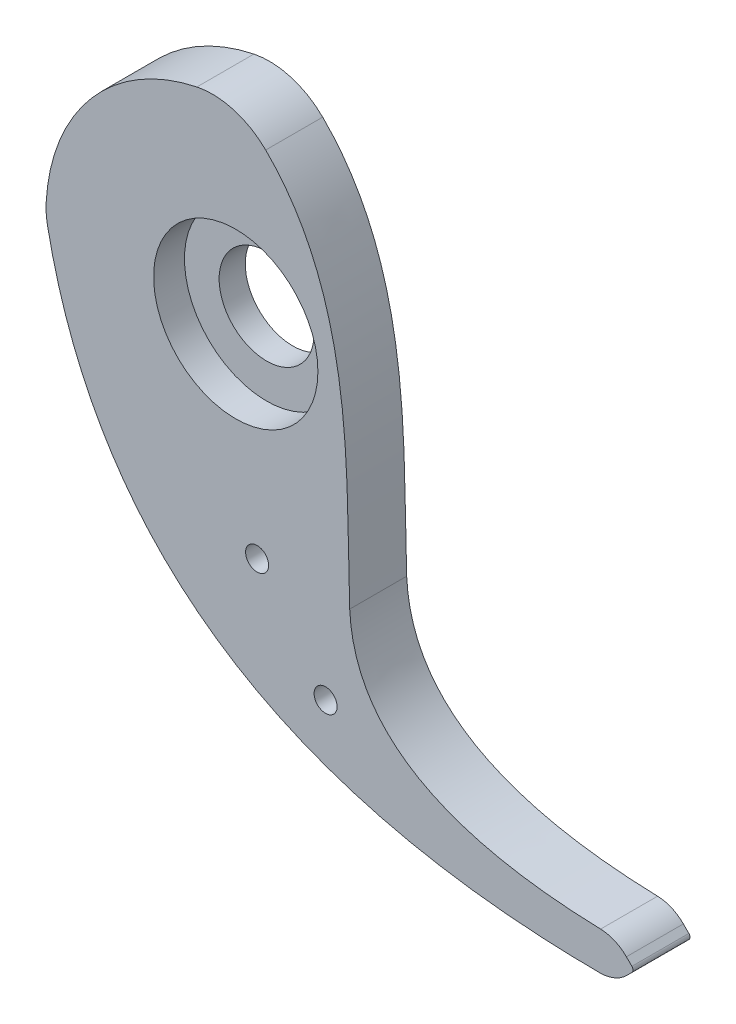
from build123d import *

# Parameters (mm, degrees)
CROQUIS1_R              = 10
SALIENTE_EXTRUIR1_DEPTH = 100
CORTAR_EXTRUIR4_DEPTH   = 15
CROQUIS3_W              = 244.799963401
CROQUIS3_H              = 159.784694376
CORTAR_EXTRUIR5_DEPTH   = 35
CROQUIS4_W              = 177.681228393
CROQUIS4_H              = 202.290816813
CORTAR_EXTRUIR6_DEPTH   = 50
CAVIDAD1_START          = 90.384084462
CAVIDAD1_OUTLINE_R      = 5.05
CAVIDAD1_DEPTH          = 9.615915538
CAVIDAD1_START_2        = 85
CAVIDAD1_2_OUTLINE_R    = 3.03
CAVIDAD1_2_DEPTH        = 5.384084462
CROQUIS5_R              = 21
CORTAR_EXTRUIR7_DEPTH   = 8
CROQUIS6_R              = 12.5
CORTAR_EXTRUIR8_DEPTH   = 8
SALIENTE_EXTRUIR2_START = 8
CROQUIS7_R              = 21
CROQUIS7_R_2            = 12.5
SALIENTE_EXTRUIR2_DEPTH = 8
CROQUIS8_R              = 21
CORTAR_EXTRUIR9_DEPTH   = 8
CAVIDAD2_START          = 85
CAVIDAD2_OUTLINE_R      = 21.63
CAVIDAD2_DEPTH          = 8.12


# Read off the part's stored shape, not the designer's step: Cavidad1, Cavidad2
with BuildPart() as part:
    # Croquis1 → Saliente-Extruir1 (new body)
    with BuildSketch(Plane.XY):
        with BuildLine():
            Line((102.84709295, -92.84709295), (104.292893219, -94.292893219))
            ThreePointArc((104.292893219, -94.292893219), (104.585786438, -95), (104.292893219, -95.707106781))
            Line((104.292893219, -95.707106781), (102.924090823, -97.075909177))
            ThreePointArc((102.924090823, -97.075909177), (99.655924863, -99.253513567), (95.801242309, -100.004707302))
            add(Edge.make_bspline(
                [(-49.58600728, -2.205776949), (-47.044709507, -15.23286343), (-27.045253615, -73.563310407), (28.636670051, -99.656919769), (95.801242309, -100.004707302)],
                knots=[0.011039812, 0.011039812, 0.011039812, 0.011039812, 0.207725041, 0.983937689, 0.983937689, 0.983937689, 0.983937689], degree=3))
            ThreePointArc((-49.58600728, -2.205776949), (-49.90808847, 0.239585929), (-49.92672205, 2.705998037))
            ThreePointArc((-49.92672205, 2.705998037), (-37.935964584, 32.570885635), (-10.229250857, 48.942439936))
            ThreePointArc((-10.229250857, 48.942439936), (-0.503550938, 48.555514737), (7.88775097, 43.623476385))
            add(Edge.make_bspline(
                [(30, -50), (29.065577858, -23.91659264), (31.451883129, 15.353668912), (10.5535399, 41.001196903), (7.88775097, 43.623476385)],
                knots=[0, 0, 0, 0, 0.805376889, 0.908560603, 0.908560603, 0.908560603, 0.908560603], degree=3))
            add(Edge.make_bspline(
                [(96.061432126, -89.922234449), (74.639632489, -89.310592156), (42.207594165, -82.045244121), (30.598677739, -62.69576919), (30, -50)],
                knots=[0.027764728, 0.027764728, 0.027764728, 0.027764728, 0.487449894, 0.947135059, 0.947135059, 0.947135059, 0.947135059], degree=3))
            ThreePointArc((96.061432126, -89.922234449), (99.734323975, -90.734922209), (102.84709295, -92.84709295))
        make_face()
        Circle(CROQUIS1_R, mode=Mode.SUBTRACT)
    extrude(amount=SALIENTE_EXTRUIR1_DEPTH)

    # Croquis2 → Cortar-Extruir4 (cut)
    with BuildSketch(Plane(origin=(0, 0, 0), x_dir=(-1, 0, 0), z_dir=(0, 0, -1))):
        with BuildLine():
            ThreePointArc((1.102623365, 39.984799883), (1.653330869, 39.965816607), (2.203724614, 39.939248839))
            ThreePointArc((2.203724614, 39.939248839), (3.208029629, 37.678468026), (3.853201686, 35.290265468))
            ThreePointArc((3.853201686, 35.290265468), (4.391380959, 35.227344113), (4.928537187, 35.156215968))
            ThreePointArc((4.928537187, 35.156215968), (6.140272041, 37.312939662), (7.668866774, 39.257973488))
            ThreePointArc((7.668866774, 39.257973488), (8.208938801, 39.148605643), (8.747452981, 39.031808392))
            ThreePointArc((8.747452981, 39.031808392), (9.365948293, 36.63655851), (9.609235823, 34.174736091))
            ThreePointArc((9.609235823, 34.174736091), (10.129718517, 34.024091505), (10.647841327, 33.865520446))
            ThreePointArc((10.647841327, 33.865520446), (12.198034749, 35.793384238), (14.025923488, 37.460291914))
            ThreePointArc((14.025923488, 37.460291914), (14.540628281, 37.263522769), (15.052573634, 37.05968196))
            ThreePointArc((15.052573634, 37.05968196), (15.268388303, 34.595299183), (15.103155055, 32.127009001))
            ThreePointArc((15.103155055, 32.127009001), (15.591743761, 31.892750375), (16.076700112, 31.651061807))
            ThreePointArc((16.076700112, 31.651061807), (17.923066867, 33.297478598), (20.000389573, 34.640791229))
            ThreePointArc((20.000389573, 34.640791229), (20.475687326, 34.361988134), (20.947099317, 34.076664012))
            ThreePointArc((20.947099317, 34.076664012), (20.754346482, 31.610370276), (20.18509959, 29.202940855))
            ThreePointArc((20.18509959, 29.202940855), (20.628466879, 28.891458153), (21.067028427, 28.57324471))
            ThreePointArc((21.067028427, 28.57324471), (23.159204443, 29.893304542), (25.429297167, 30.87638006))
            ThreePointArc((25.429297167, 30.87638006), (25.852222997, 30.523148037), (26.270242736, 30.164123501))
            ThreePointArc((26.270242736, 30.164123501), (25.674180192, 27.763192871), (24.716447225, 25.482292608))
            ThreePointArc((24.716447225, 25.482292608), (25.102499195, 25.102082267), (25.482703124, 24.716023982))
            ThreePointArc((25.482703124, 24.716023982), (27.763619294, 25.673719065), (30.164559823, 26.269741732))
            ThreePointArc((30.164559823, 26.269741732), (30.523577417, 25.85171603), (30.876802415, 25.428784332))
            ThreePointArc((30.876802415, 25.428784332), (29.893689193, 23.158707937), (28.573594612, 21.066553846))
            ThreePointArc((28.573594612, 21.066553846), (28.891800771, 20.627987013), (29.203276108, 20.18461455))
            ThreePointArc((29.203276108, 20.18461455), (31.610714984, 20.753821458), (34.077011921, 20.94653333))
            ThreePointArc((34.077011921, 20.94653333), (34.362328213, 20.4751166), (34.641123413, 19.999814215))
            ThreePointArc((34.641123413, 19.999814215), (33.297776281, 17.922513822), (31.651328823, 16.076174412))
            ThreePointArc((31.651328823, 16.076174412), (31.893009337, 15.591214047), (32.127259848, 15.102621451))
            ThreePointArc((32.127259848, 15.102621451), (34.595552773, 15.267813702), (37.059931966, 15.051958102))
            ThreePointArc((37.059931966, 15.051958102), (37.263764272, 14.540009363), (37.460524868, 14.025301302))
            ThreePointArc((37.460524868, 14.025301302), (35.793586832, 12.197440249), (33.865697293, 10.647278847))
            ThreePointArc((33.865697293, 10.647278847), (34.024259747, 10.129153404), (34.174895688, 9.608668207))
            ThreePointArc((34.174895688, 9.608668207), (36.636714066, 9.365339789), (39.031953674, 8.746804694))
            ThreePointArc((39.031953674, 8.746804694), (39.148741981, 8.208288574), (39.258100856, 7.668214731))
            ThreePointArc((39.258100856, 7.668214731), (37.313041641, 6.139652303), (35.156297822, 4.927953271))
            ThreePointArc((35.156297822, 4.927953271), (35.227417046, 4.390795861), (35.290329461, 3.852615543))
            ThreePointArc((35.290329461, 3.852615543), (37.678521304, 3.20740382), (39.939285436, 2.203061256))
            ThreePointArc((39.939285436, 2.203061256), (39.965844062, 1.65266707), (39.984818192, 1.101959251))
            ThreePointArc((39.984818192, 1.101959251), (37.814693942, -0.085609353), (35.487926192, -0.925794025))
            ThreePointArc((35.487926192, -0.925794025), (35.469662238, -1.467331147), (35.443135042, -2.00852643))
            ThreePointArc((35.443135042, -2.00852643), (37.692556701, -3.038021764), (39.757177604, -4.400775951))
            ThreePointArc((39.757177604, -4.400775951), (39.692782099, -4.948034883), (39.620853919, -5.494354805))
            ThreePointArc((39.620853919, -5.494354805), (37.284859968, -6.308535809), (34.851536446, -6.754288072))
            ThreePointArc((34.851536446, -6.754288072), (34.744387508, -7.285433186), (34.629144292, -7.814881038))
            ThreePointArc((34.629144292, -7.814881038), (36.678437409, -9.200578033), (38.490597607, -10.884571461))
            ThreePointArc((38.490597607, -10.884571461), (38.337004513, -11.413767343), (38.176136036, -11.940797184))
            ThreePointArc((38.176136036, -11.940797184), (35.737992209, -12.359381853), (33.264487636, -12.398542748))
            ThreePointArc((33.264487636, -12.398542748), (33.071376458, -12.904807599), (32.870560757, -13.408066063))
            ThreePointArc((32.870560757, -13.408066063), (34.663825958, -15.112166519), (36.174094444, -17.071464236))
            ThreePointArc((36.174094444, -17.071464236), (35.935493381, -17.568161984), (35.690072679, -18.061525743))
            ThreePointArc((35.690072679, -18.061525743), (33.216285184, -18.073096179), (30.770070318, -17.704597499))
            ThreePointArc((30.770070318, -17.704597499), (30.496264469, -18.172172502), (30.215354012, -18.635513998))
            ThreePointArc((30.215354012, -18.635513998), (31.703675696, -20.611534496), (32.870856284, -22.792691969))
            ThreePointArc((32.870856284, -22.792691969), (32.553755666, -23.243342962), (32.230477177, -23.689582963))
            ThreePointArc((32.230477177, -23.689582963), (29.788524487, -23.293823554), (27.436325694, -22.527716982))
            ThreePointArc((27.436325694, -22.527716982), (27.089293883, -22.94384791), (26.735951175, -23.35463369))
            ThreePointArc((26.735951175, -23.35463369), (27.878731807, -25.548673542), (28.670986852, -27.89219448))
            ThreePointArc((28.670986852, -27.89219448), (28.284036357, -28.284506136), (27.891718275, -28.671450114))
            ThreePointArc((27.891718275, -28.671450114), (25.548210496, -27.879156145), (23.354189625, -26.736339072))
            ThreePointArc((23.354189625, -26.736339072), (22.943397976, -27.089674957), (22.527261285, -27.436699856))
            ThreePointArc((22.527261285, -27.436699856), (23.293328789, -29.788911374), (23.689047639, -32.230870636))
            ThreePointArc((23.689047639, -32.230870636), (23.242802268, -32.554141714), (22.792146008, -32.871234847))
            ThreePointArc((22.792146008, -32.871234847), (20.611007921, -31.704018032), (18.635012143, -30.215663528))
            ThreePointArc((18.635012143, -30.215663528), (18.171665982, -30.496566289), (17.704086432, -30.770364373))
            ThreePointArc((17.704086432, -30.770364373), (18.072544482, -33.216585358), (18.060932958, -35.690372661))
            ThreePointArc((18.060932958, -35.690372661), (17.567565123, -35.935785168), (17.070863412, -36.174377982))
            ThreePointArc((17.070863412, -36.174377982), (15.111590779, -34.664076954), (13.407520108, -32.870783449))
            ThreePointArc((13.407520108, -32.870783449), (12.90425831, -33.071590791), (12.397990251, -33.264693561))
            ThreePointArc((12.397990251, -33.264693561), (12.358788274, -35.738197483), (11.940163108, -38.176334357))
            ThreePointArc((11.940163108, -38.176334357), (11.413130596, -38.337194081), (10.883932163, -38.490778385))
            ThreePointArc((10.883932163, -38.490778385), (9.199968834, -36.678590218), (7.814305875, -34.629274085))
            ThreePointArc((7.814305875, -34.629274085), (7.28485611, -34.744508508), (6.753709216, -34.851648624))
            ThreePointArc((6.753709216, -34.851648624), (6.307916538, -37.284964743), (5.493696735, -39.62094517))
            ThreePointArc((5.493696735, -39.62094517), (4.947375618, -39.692864277), (4.400115616, -39.757250692))
            ThreePointArc((4.400115616, -39.757250692), (3.037395721, -37.692607155), (2.007937749, -35.443168397))
            ThreePointArc((2.007937749, -35.443168397), (1.466742025, -35.469686605), (0.9252046, -35.487941564))
            ThreePointArc((0.9252046, -35.487941564), (0.084981283, -37.814695359), (-1.102623365, -39.984799883))
            ThreePointArc((-1.102623365, -39.984799883), (-1.653330869, -39.965816607), (-2.203724614, -39.939248839))
            ThreePointArc((-2.203724614, -39.939248839), (-3.208029629, -37.678468026), (-3.853201686, -35.290265468))
            ThreePointArc((-3.853201686, -35.290265468), (-4.391380959, -35.227344113), (-4.928537187, -35.156215968))
            ThreePointArc((-4.928537187, -35.156215968), (-6.140272041, -37.312939662), (-7.668866774, -39.257973488))
            ThreePointArc((-7.668866774, -39.257973488), (-8.208938801, -39.148605643), (-8.747452981, -39.031808392))
            ThreePointArc((-8.747452981, -39.031808392), (-9.365948293, -36.63655851), (-9.609235823, -34.174736091))
            ThreePointArc((-9.609235823, -34.174736091), (-10.129718517, -34.024091505), (-10.647841327, -33.865520446))
            ThreePointArc((-10.647841327, -33.865520446), (-12.198034749, -35.793384238), (-14.025923488, -37.460291914))
            ThreePointArc((-14.025923488, -37.460291914), (-14.540628281, -37.263522769), (-15.052573634, -37.05968196))
            ThreePointArc((-15.052573634, -37.05968196), (-15.268388303, -34.595299183), (-15.103155055, -32.127009001))
            ThreePointArc((-15.103155055, -32.127009001), (-15.591743761, -31.892750375), (-16.076700112, -31.651061807))
            ThreePointArc((-16.076700112, -31.651061807), (-17.923066867, -33.297478598), (-20.000389573, -34.640791229))
            ThreePointArc((-20.000389573, -34.640791229), (-20.475687326, -34.361988134), (-20.947099317, -34.076664012))
            ThreePointArc((-20.947099317, -34.076664012), (-20.754346482, -31.610370276), (-20.18509959, -29.202940855))
            ThreePointArc((-20.18509959, -29.202940855), (-20.628466879, -28.891458153), (-21.067028427, -28.57324471))
            ThreePointArc((-21.067028427, -28.57324471), (-23.159204443, -29.893304542), (-25.429297167, -30.87638006))
            ThreePointArc((-25.429297167, -30.87638006), (-25.852222997, -30.523148037), (-26.270242736, -30.164123501))
            ThreePointArc((-26.270242736, -30.164123501), (-25.674180192, -27.763192871), (-24.716447225, -25.482292608))
            ThreePointArc((-24.716447225, -25.482292608), (-25.102499195, -25.102082267), (-25.482703124, -24.716023982))
            ThreePointArc((-25.482703124, -24.716023982), (-27.421409872, -25.555856409), (-29.453588357, -26.133916065))
            add(Edge.make_bspline(
                [(-30, -50), (-29.734872846, -42.599255467), (-29.715262914, -34.495945215), (-29.453588357, -26.133916065)],
                knots=[0, 0, 0, 0, 0.228512653, 0.228512653, 0.228512653, 0.228512653], degree=3))
            add(Edge.make_bspline(
                [(-96.061432126, -89.922234449), (-74.639632489, -89.310592156), (-42.207594165, -82.045244121), (-30.598677739, -62.69576919), (-30, -50)],
                knots=[0.027764728, 0.027764728, 0.027764728, 0.027764728, 0.487449894, 0.947135059, 0.947135059, 0.947135059, 0.947135059], degree=3))
            ThreePointArc((-96.061432126, -89.922234449), (-99.734323975, -90.734922209), (-102.84709295, -92.84709295))
            Line((-102.84709295, -92.84709295), (-104.292893219, -94.292893219))
            ThreePointArc((-104.292893219, -94.292893219), (-104.585786438, -95), (-104.292893219, -95.707106781))
            Line((-104.292893219, -95.707106781), (-102.924090823, -97.075909177))
            ThreePointArc((-102.924090823, -97.075909177), (-99.655924863, -99.253513567), (-95.801242309, -100.004707302))
            add(Edge.make_bspline(
                [(49.58600728, -2.205776949), (47.044709507, -15.23286343), (27.045253615, -73.563310407), (-28.636670051, -99.656919769), (-95.801242309, -100.004707302)],
                knots=[0.011039812, 0.011039812, 0.011039812, 0.011039812, 0.207725041, 0.983937689, 0.983937689, 0.983937689, 0.983937689], degree=3))
            ThreePointArc((49.58600728, -2.205776949), (49.90808847, 0.239585929), (49.92672205, 2.705998037))
            ThreePointArc((49.92672205, 2.705998037), (37.935964584, 32.570885635), (10.229250857, 48.942439936))
            ThreePointArc((10.229250857, 48.942439936), (0.503550938, 48.555514737), (-7.88775097, 43.623476385))
            add(Edge.make_bspline(
                [(-15.182020199, 34.727214957), (-15.121605489, 34.818294405), (-12.99668952, 38.002837294), (-10.5535399, 41.001196903), (-7.88775097, 43.623476385)],
                knots=[0.802344073, 0.802344073, 0.802344073, 0.802344073, 0.805376889, 0.908560603, 0.908560603, 0.908560603, 0.908560603], degree=3))
            ThreePointArc((-15.182020199, 34.727214957), (-14.257602386, 33.834526615), (-13.407520108, 32.870783449))
            ThreePointArc((-13.407520108, 32.870783449), (-12.90425831, 33.071590791), (-12.397990251, 33.264693561))
            ThreePointArc((-12.397990251, 33.264693561), (-12.358788274, 35.738197483), (-11.940163108, 38.176334357))
            ThreePointArc((-11.940163108, 38.176334357), (-11.413130596, 38.337194081), (-10.883932163, 38.490778385))
            ThreePointArc((-10.883932163, 38.490778385), (-9.199968834, 36.678590218), (-7.814305875, 34.629274085))
            ThreePointArc((-7.814305875, 34.629274085), (-7.28485611, 34.744508508), (-6.753709216, 34.851648624))
            ThreePointArc((-6.753709216, 34.851648624), (-6.307916538, 37.284964743), (-5.493696735, 39.62094517))
            ThreePointArc((-5.493696735, 39.62094517), (-4.947375618, 39.692864277), (-4.400115616, 39.757250692))
            ThreePointArc((-4.400115616, 39.757250692), (-3.037395721, 37.692607155), (-2.007937749, 35.443168397))
            ThreePointArc((-2.007937749, 35.443168397), (-1.466742025, 35.469686605), (-0.9252046, 35.487941564))
            ThreePointArc((-0.9252046, 35.487941564), (-0.084981283, 37.814695359), (1.102623365, 39.984799883))
        make_face()
    extrude(amount=-CORTAR_EXTRUIR4_DEPTH, mode=Mode.SUBTRACT)

    # Croquis3 → Cortar-Extruir5 (cut)
    with BuildSketch(Plane(origin=(0, 0, 0), x_dir=(-1, 0, 0), z_dir=(0, 0, -1))):
        with Locations((-26.261343778, -29.231181028)):
            Rectangle(CROQUIS3_W, CROQUIS3_H)
    extrude(amount=-CORTAR_EXTRUIR5_DEPTH, mode=Mode.SUBTRACT)

    # Croquis4 → Cortar-Extruir6 (cut)
    with BuildSketch(Plane(origin=(0, 0, 35), x_dir=(-1, 0, 0), z_dir=(0, 0, -1))):
        with Locations((-31.414152083, -26.798932517)):
            Rectangle(CROQUIS4_W, CROQUIS4_H)
    extrude(amount=-CORTAR_EXTRUIR6_DEPTH, mode=Mode.SUBTRACT)

    # Cavidad1 outline → Cavidad1 (cut)
    with BuildSketch(Plane.XY.offset(CAVIDAD1_START)):
        with Locations((5.62196341, -50.701498074)):
            Circle(CAVIDAD1_OUTLINE_R)
        with Locations((23.651318082, -73.91381178)):
            Circle(CAVIDAD1_OUTLINE_R)
    extrude(amount=CAVIDAD1_DEPTH, mode=Mode.SUBTRACT)

    # Cavidad1 2 outline → Cavidad1 2 (cut)
    with BuildSketch(Plane.XY.offset(CAVIDAD1_START_2)):
        with Locations((5.62196341, -50.701498074)):
            Circle(CAVIDAD1_2_OUTLINE_R)
        with Locations((23.651318082, -73.91381178)):
            Circle(CAVIDAD1_2_OUTLINE_R)
    extrude(amount=CAVIDAD1_2_DEPTH, mode=Mode.SUBTRACT)

    # Croquis5 → Cortar-Extruir7 (cut)
    with BuildSketch(Plane.XY.offset(100)):
        Circle(CROQUIS5_R)
    extrude(amount=-CORTAR_EXTRUIR7_DEPTH, mode=Mode.SUBTRACT)

    # Croquis6 → Cortar-Extruir8 (cut)
    with BuildSketch(Plane.XY.offset(92)):
        Circle(CROQUIS6_R)
    extrude(amount=-CORTAR_EXTRUIR8_DEPTH, mode=Mode.SUBTRACT)

    # Croquis7 → Saliente-Extruir2 (add)
    with BuildSketch(Plane.XY.offset(92).offset(SALIENTE_EXTRUIR2_START)):
        Circle(CROQUIS7_R)
        Circle(CROQUIS7_R_2, mode=Mode.SUBTRACT)
    extrude(amount=-SALIENTE_EXTRUIR2_DEPTH)

    # Croquis8 → Cortar-Extruir9 (cut)
    with BuildSketch(Plane(origin=(0, 0, 85), x_dir=(-1, 0, 0), z_dir=(0, 0, -1))):
        Circle(CROQUIS8_R)
    extrude(amount=-CORTAR_EXTRUIR9_DEPTH, mode=Mode.SUBTRACT)

    # Cavidad2 outline → Cavidad2 (cut)
    with BuildSketch(Plane.XY.offset(CAVIDAD2_START)):
        Circle(CAVIDAD2_OUTLINE_R)
    extrude(amount=CAVIDAD2_DEPTH, mode=Mode.SUBTRACT)


with BuildPart() as body_2:
    # Simetría1: mirrored copy
    add(part.part.mirror(Plane.XY.offset(85)))


solid = body_2.part
